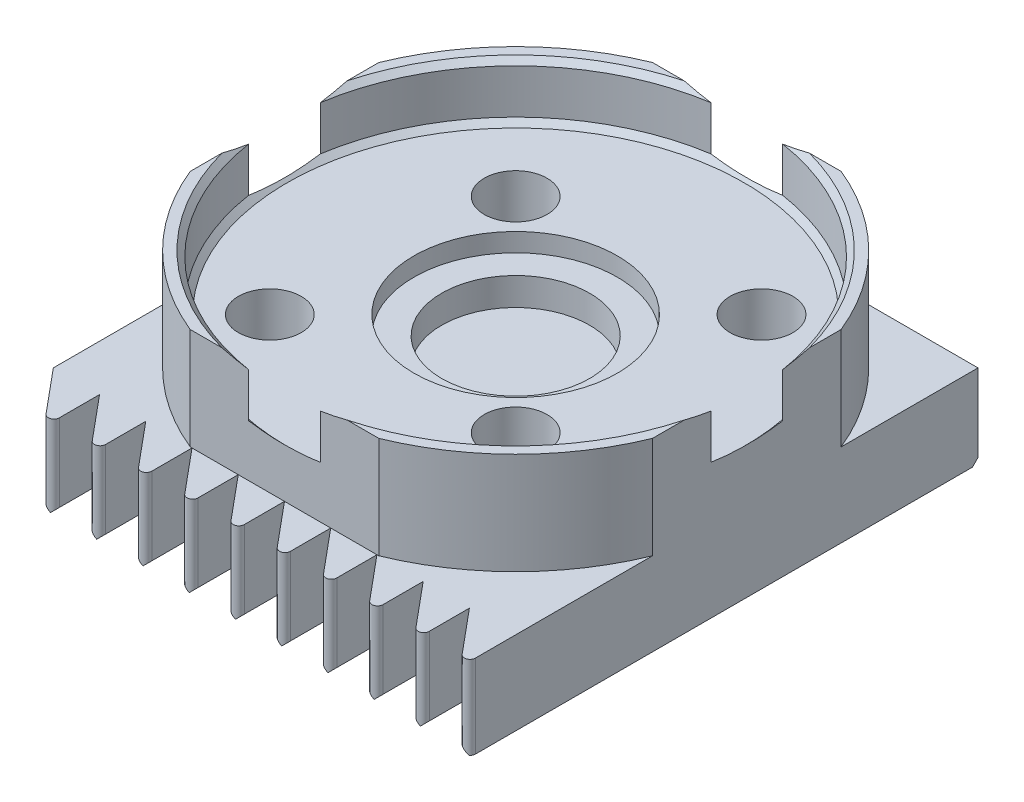
from build123d import *

# Parameters (mm, degrees)
SKETCH1_R           = 13.5
SKETCH1_R_2         = 1.7
SKETCH1_R_3         = 5.5
BOSS_EXTRUDE1_DEPTH = 2.5
SKETCH2_R           = 13.5
SKETCH2_R_2         = 12.65
BOSS_EXTRUDE2_DEPTH = 3
SKETCH3_W           = 25
SKETCH3_H           = 25
SKETCH3_R           = 3
BOSS_EXTRUDE3_DEPTH = 4.5
CHAMFER2_SIZE       = 0.3
SKETCH4_R           = 4
BOSS_EXTRUDE4_DEPTH = 1.5
CUT_EXTRUDE1_DEPTH  = 20.868316486
CHAMFER3_SIZE       = 0.3
BOSS_EXTRUDE5_DEPTH = 4.5
CHAMFER4_SIZE       = 0.3
FILLET1_R           = 0.3
SKETCH8_R           = 1.5
CUT_EXTRUDE2_DEPTH  = 3
CHAMFER5_SIZE       = 2


with BuildPart() as part:
    # Sketch1 → Boss-Extrude1 (new body)
    with BuildSketch(Plane(origin=(0, 0, 0), x_dir=(1, 0, 0), z_dir=(0, 1, 0))):
        with Locations(Location((0, 0, 0), (0, 0, 270))):
            Circle(SKETCH1_R)
        with Locations(Location((6.646803743, 6.646803743, 0), (0, 0, 270))):
            Circle(SKETCH1_R_2, mode=Mode.SUBTRACT)
        with Locations(Location((-6.646803743, -6.646803743, 0), (0, 0, 270))):
            Circle(SKETCH1_R_2, mode=Mode.SUBTRACT)
        with Locations(Location((5.533110563, -5.533110563, 0), (0, 0, 270))):
            Circle(SKETCH1_R_2, mode=Mode.SUBTRACT)
        with Locations(Location((-5.533110563, 5.533110563, 0), (0, 0, 270))):
            Circle(SKETCH1_R_2, mode=Mode.SUBTRACT)
        with Locations(Location((0, 0, 0), (0, 0, 270))):
            Circle(SKETCH1_R_3, mode=Mode.SUBTRACT)
    extrude(amount=BOSS_EXTRUDE1_DEPTH)

    # Sketch2 → Boss-Extrude2 (add)
    with BuildSketch(Plane(origin=(0, 2.5, 0), x_dir=(1, 0, 0), z_dir=(0, 1, 0))):
        with Locations(Location((0, 0, 0), (0, 0, 270))):
            Circle(SKETCH2_R)
        with Locations(Location((0, 0, 0), (0, 0, 270))):
            Circle(SKETCH2_R_2, mode=Mode.SUBTRACT)
    extrude(amount=BOSS_EXTRUDE2_DEPTH)

    # Sketch3 → Boss-Extrude3 (add)
    with BuildSketch(Plane.XZ):
        Rectangle(SKETCH3_W, SKETCH3_H)
        with Locations(Location((-6.646803743, 6.646803743, 0), (0, 0, 270))):
            Circle(SKETCH3_R, mode=Mode.SUBTRACT)
        with Locations(Location((5.533110563, 5.533110563, 0), (0, 0, 193.381478788))):
            Circle(SKETCH3_R, mode=Mode.SUBTRACT)
        with Locations(Location((6.646803743, -6.646803743, 0), (0, 0, 270))):
            Circle(SKETCH3_R, mode=Mode.SUBTRACT)
        with Locations(Location((-5.533110563, -5.533110563, 0), (0, 0, 76.618521212))):
            Circle(SKETCH3_R, mode=Mode.SUBTRACT)
    extrude(amount=BOSS_EXTRUDE3_DEPTH)

    # Chamfer2
    chamfer2_edges = [part.edges().sort_by_distance(p)[0] for p in [
        (0, 2.5, -12.65),
    ]]
    chamfer(chamfer2_edges, length=CHAMFER2_SIZE)

    # Sketch4 → Boss-Extrude4 (add)
    # profile 1 of 3: a face of its own
    with BuildSketch(Plane(origin=(0, 0, 0), x_dir=(1, 0, 0), z_dir=(0, 1, 0))):
        with BuildLine():
            ThreePointArc((-4.838810256, 2.614558339), (-3.889087297, -3.889087297), (2.614558339, -4.838810256))
            ThreePointArc((2.614558339, -4.838810256), (3.411790219, -3.411790219), (4.838810256, -2.614558339))
            ThreePointArc((4.838810256, -2.614558339), (3.889087297, 3.889087297), (-2.614558339, 4.838810256))
            ThreePointArc((-2.614558339, 4.838810256), (-3.411790219, 3.411790219), (-4.838810256, 2.614558339))
        make_face()
        with Locations(Location((0, 0, 0), (0, 0, 270))):
            Circle(SKETCH4_R, mode=Mode.SUBTRACT)
    # profile 2 of 3: a face of its own
    with BuildSketch(Plane(origin=(0, 0, 0), x_dir=(1, 0, 0), z_dir=(0, 1, 0))):
        with BuildLine():
            ThreePointArc((-4.838810256, 2.614558339), (-3.411790219, 3.411790219), (-2.614558339, 4.838810256))
            ThreePointArc((-2.614558339, 4.838810256), (-3.889087297, 3.889087297), (-4.838810256, 2.614558339))
        make_face()
    # profile 3 of 3: a face of its own
    with BuildSketch(Plane(origin=(0, 0, 0), x_dir=(1, 0, 0), z_dir=(0, 1, 0))):
        with BuildLine():
            ThreePointArc((2.614558339, -4.838810256), (3.889087297, -3.889087297), (4.838810256, -2.614558339))
            ThreePointArc((4.838810256, -2.614558339), (3.411790219, -3.411790219), (2.614558339, -4.838810256))
        make_face()
    extrude(amount=BOSS_EXTRUDE4_DEPTH)

    # Sketch6 → Cut-Extrude1 (cut, through all)
    with BuildSketch(Plane.XZ):
        with BuildLine():
            Line((5.099019514, -12.5), (-5.099019514, -12.5))
            ThreePointArc((-5.099019514, -12.5), (0, -13.5), (5.099019514, -12.5))
        make_face()
        with BuildLine():
            Line((12.5, 5.099019514), (12.5, -5.099019514))
            ThreePointArc((12.5, -5.099019514), (13.5, 0), (12.5, 5.099019514))
        make_face()
        with BuildLine():
            Line((-5.099019514, 12.5), (5.099019514, 12.5))
            ThreePointArc((5.099019514, 12.5), (0, 13.5), (-5.099019514, 12.5))
        make_face()
        with BuildLine():
            Line((-12.5, -5.099019514), (-12.5, 5.099019514))
            ThreePointArc((-12.5, 5.099019514), (-13.5, 0), (-12.5, -5.099019514))
        make_face()
    extrude(amount=-CUT_EXTRUDE1_DEPTH, mode=Mode.SUBTRACT)

    # Chamfer3
    chamfer3_edges = [part.edges().sort_by_distance(p)[0] for p in [
        (8.944900782, 5.5, -8.944900782),
        (-8.944900782, 5.5, -8.944900782),
        (-8.944900782, 5.5, 8.944900782),
        (8.944900782, 5.5, 8.944900782),
    ]]
    chamfer(chamfer3_edges, length=CHAMFER3_SIZE)

    # Sketch7 → Boss-Extrude5 (add)
    with BuildSketch(Plane.XZ.offset(4.5)):
        Polygon((-12.5, 12.5), (-10, 12.5), (-10, 15.5), align=None)
        Polygon((-10, 12.5), (-7.5, 12.5), (-7.5, 15.5), align=None)
        Polygon((-7.5, 12.5), (-5, 12.5), (-5, 15.5), align=None)
        Polygon((-5, 12.5), (-2.5, 12.5), (-2.5, 15.5), align=None)
        Polygon((-2.5, 12.5), (0, 12.5), (0, 15.5), align=None)
        Polygon((0, 12.5), (2.5, 12.5), (2.5, 15.5), align=None)
        Polygon((2.5, 12.5), (5, 12.5), (5, 15.5), align=None)
        Polygon((5, 12.5), (7.5, 12.5), (7.5, 15.5), align=None)
        Polygon((7.5, 12.5), (10, 12.5), (10, 15.5), align=None)
        Polygon((10, 12.5), (12.5, 12.5), (12.5, 15.5), align=None)
    extrude(amount=-BOSS_EXTRUDE5_DEPTH)

    # Chamfer4
    chamfer4_edges = [part.edges().sort_by_distance(p)[0] for p in [
        (-11.25, -4.5, 14),
        (-10, -4.5, 14),
        (-7.5, -4.5, 14),
        (-8.75, -4.5, 14),
        (-5, -4.5, 14),
        (-6.25, -4.5, 14),
        (-2.5, -4.5, 14),
        (-3.75, -4.5, 14),
        (0, -4.5, 14),
        (-1.25, -4.5, 14),
        (2.5, -4.5, 14),
        (1.25, -4.5, 14),
        (5, -4.5, 14),
        (3.75, -4.5, 14),
        (7.5, -4.5, 14),
        (6.25, -4.5, 14),
        (10, -4.5, 14),
        (8.75, -4.5, 14),
        (11.25, -4.5, 14),
        (0, -4.5, -12.5),
    ]]
    chamfer(chamfer4_edges, length=CHAMFER4_SIZE)

    # Fillet1
    fillet1_edges = [part.edges().sort_by_distance(p)[0] for p in [
        (10, -2.1, 15.5),
        (7.5, -2.1, 15.5),
        (5, -2.1, 15.5),
        (2.5, -2.1, 15.5),
        (0, -2.1, 15.5),
        (-2.5, -2.1, 15.5),
        (-5, -2.1, 15.5),
        (-7.5, -2.1, 15.5),
        (-10, -2.1, 15.5),
        (12.5, -2.1, 15.5),
    ]]
    fillet(fillet1_edges, radius=FILLET1_R)

    # Sketch8 → Cut-Extrude2 (cut)
    with BuildSketch(Plane.XZ.offset(4.5)):
        with Locations(Location((0, 0, 0), (0, 0, 270))):
            Circle(SKETCH8_R)
    extrude(amount=-CUT_EXTRUDE2_DEPTH, mode=Mode.SUBTRACT)

    # Chamfer5
    # the kernel refuses this chamfer: 2 mm, written as the material it adds along each edge
    with BuildSketch(Plane(origin=(-5.533110563, 0, -5.533110563), x_dir=(0.2314334356248564, 0, 0.9728507413138335), z_dir=(0.9728507413138335, 0, -0.2314334356248564))) as chamfer5_piece_1_section:
        Polygon((3, CHAMFER5_SIZE), (3 - CHAMFER5_SIZE, 0), (3, 0), align=None)
    chamfer5_piece_1 = revolve(axis=Axis((-5.533110563, 0, -5.533110563), (0, -1, 0)), mode=Mode.PRIVATE)
    chamfer5_piece_1 = chamfer5_piece_1 - Plane(origin=(-5.533110563, -1.35638922, -5.533110563), x_dir=(0, 0, 1), z_dir=(0, -1, 0)) * Cylinder(1.7, 13, mode=Mode.PRIVATE)
    add(chamfer5_piece_1)
    with BuildSketch(Plane(origin=(5.533110563, 0, 5.533110563), x_dir=(-0.9728507413138336, 0, -0.23143343562485635), z_dir=(-0.23143343562485635, 0, 0.9728507413138336))) as chamfer5_piece_2_section:
        Polygon((3, CHAMFER5_SIZE), (3 - CHAMFER5_SIZE, 0), (3, 0), align=None)
    chamfer5_piece_2 = revolve(axis=Axis((5.533110563, 0, 5.533110563), (0, -1, 0)), mode=Mode.PRIVATE)
    chamfer5_piece_2 = chamfer5_piece_2 - Plane(origin=(5.533110563, -1.35638922, 5.533110563), x_dir=(0, 0, 1), z_dir=(0, -1, 0)) * Cylinder(1.7, 12, mode=Mode.PRIVATE)
    add(chamfer5_piece_2)
    with BuildSketch(Plane(origin=(6.646803743, 0, -6.646803743), x_dir=(0, 0, -1), z_dir=(-1, 0, 0))) as chamfer5_piece_3_section:
        Polygon((3, CHAMFER5_SIZE), (3 - CHAMFER5_SIZE, 0), (3, 0), align=None)
    chamfer5_piece_3 = revolve(axis=Axis((6.646803743, 0, -6.646803743), (0, -1, 0)), mode=Mode.PRIVATE)
    chamfer5_piece_3 = chamfer5_piece_3 - Plane(origin=(6.646803743, -1.35638922, -6.646803743), x_dir=(0, 0, 1), z_dir=(0, -1, 0)) * Cylinder(1.7, 13, mode=Mode.PRIVATE)
    add(chamfer5_piece_3)
    with BuildSketch(Plane(origin=(-6.646803743, 0, 6.646803743), x_dir=(0, 0, -1), z_dir=(-1, 0, 0))) as chamfer5_piece_4_section:
        Polygon((3, CHAMFER5_SIZE), (3 - CHAMFER5_SIZE, 0), (3, 0), align=None)
    chamfer5_piece_4 = revolve(axis=Axis((-6.646803743, 0, 6.646803743), (0, -1, 0)), mode=Mode.PRIVATE)
    chamfer5_piece_4 = chamfer5_piece_4 - Plane(origin=(-6.646803743, -1.35638922, 6.646803743), x_dir=(0, 0, 1), z_dir=(0, -1, 0)) * Cylinder(1.7, 13, mode=Mode.PRIVATE)
    add(chamfer5_piece_4)


solid = part.part
